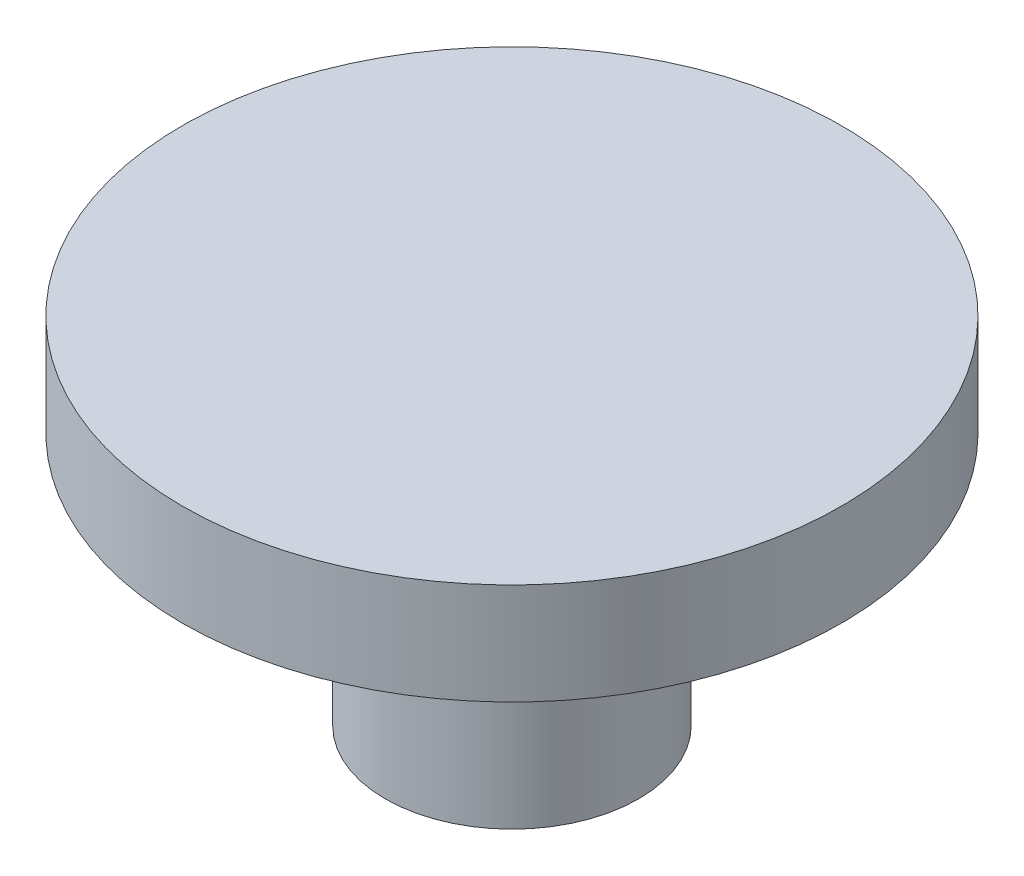
from build123d import *

# Parameters (mm, degrees)
SKETCH1_R           = 19.5
BOSS_EXTRUDE1_DEPTH = 6
SKETCH2_R           = 7.5
SKETCH2_R_2         = 2.1
BOSS_EXTRUDE2_DEPTH = 15


with BuildPart() as part:
    # Sketch1 → Boss-Extrude1 (new body)
    with BuildSketch(Plane(origin=(0, 0, 0), x_dir=(1, 0, 0), z_dir=(0, 1, 0))):
        Circle(SKETCH1_R)
    extrude(amount=BOSS_EXTRUDE1_DEPTH)

    # Sketch2 → Boss-Extrude2 (add)
    with BuildSketch(Plane.XZ):
        Circle(SKETCH2_R)
        Circle(SKETCH2_R_2, mode=Mode.SUBTRACT)
    extrude(amount=BOSS_EXTRUDE2_DEPTH)


solid = part.part
